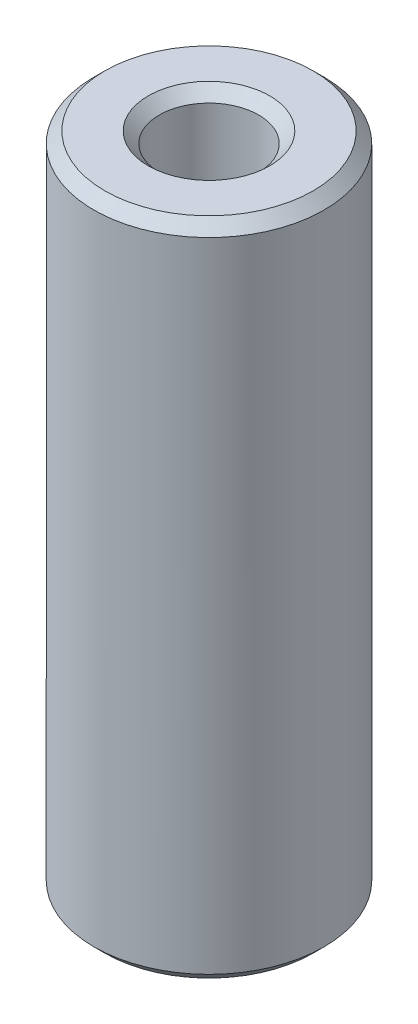
from build123d import *

# Parameters (mm, degrees)
SKETCH1_R           = 10
BOSS_EXTRUDE1_DEPTH = 57.354683477
SKETCH2_R           = 4.315109166
CUT_EXTRUDE1_DEPTH  = 60.072495433
CHAMFER1_SIZE       = 0.95945155


with BuildPart() as part:
    # Sketch1 → Boss-Extrude1 (new body)
    with BuildSketch(Plane(origin=(0, 0, 0), x_dir=(1, 0, 0), z_dir=(0, 1, 0))):
        Circle(SKETCH1_R)
    extrude(amount=BOSS_EXTRUDE1_DEPTH)

    # Sketch2 → Cut-Extrude1 (cut, through all)
    with BuildSketch(Plane(origin=(0, 0, 0), x_dir=(1, 0, 0), z_dir=(0, 1, 0))):
        Circle(SKETCH2_R)
    extrude(amount=CUT_EXTRUDE1_DEPTH, mode=Mode.SUBTRACT)

    # Chamfer1
    chamfer1_edges = [part.edges().sort_by_distance(p)[0] for p in [
        (-4.315109166, 57.354683477, 0),
        (-4.315109166, 0, 0),
        (-10, 0, 0),
        (-10, 57.354683477, 0),
    ]]
    chamfer(chamfer1_edges, length=CHAMFER1_SIZE)


solid = part.part
